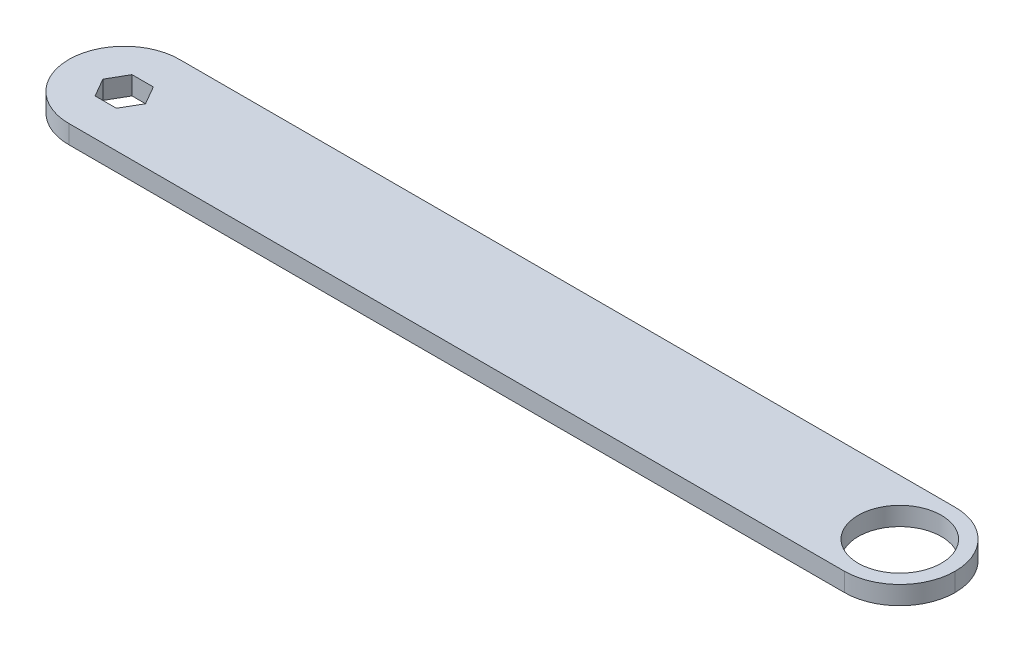
from build123d import *

# Parameters (mm, degrees)
SKETCH1_W           = 304.8
SKETCH1_H           = 38.1
BOSS_EXTRUDE1_DEPTH = 6.35
SKETCH2_R           = 14.3002
CUT_EXTRUDE1_DEPTH  = 6.35
CUT_EXTRUDE5_DEPTH  = 6.35
FILLET3_R           = 19.05


with BuildPart() as part:
    # Sketch1 → Boss-Extrude1 (new body)
    with BuildSketch(Plane(origin=(0, 0, 0), x_dir=(1, 0, 0), z_dir=(0, 1, 0))):
        Rectangle(SKETCH1_W, SKETCH1_H)
    extrude(amount=BOSS_EXTRUDE1_DEPTH)

    # Sketch2 → Cut-Extrude1 (cut)
    with BuildSketch(Plane(origin=(0, 6.35, 0), x_dir=(1, 0, 0), z_dir=(0, 1, 0))):
        with Locations(Location((133.35, 0, 0), (0, 0, 270))):
            Circle(SKETCH2_R)
    extrude(amount=-CUT_EXTRUDE1_DEPTH, mode=Mode.SUBTRACT)

    # Sketch8 → Cut-Extrude5 (cut)
    with BuildSketch(Plane(origin=(0, 6.35, 0), x_dir=(1, 0, 0), z_dir=(0, 1, 0))):
        Polygon((-129.683825791, 6.35), (-137.016174209, 6.35), (-140.682348419, 0), (-137.016174209, -6.35), (-129.683825791, -6.35), (-126.017651581, 0), align=None)
    extrude(amount=-CUT_EXTRUDE5_DEPTH, mode=Mode.SUBTRACT)

    # Fillet3
    fillet3_edges = [part.edges().sort_by_distance(p)[0] for p in [
        (152.4, 3.175, 19.05),
        (152.4, 3.175, -19.05),
        (-152.4, 3.175, 19.05),
        (-152.4, 3.175, -19.05),
    ]]
    fillet(fillet3_edges, radius=FILLET3_R - 0.0001)  # a hair under: the kernel refuses the full size


solid = part.part
